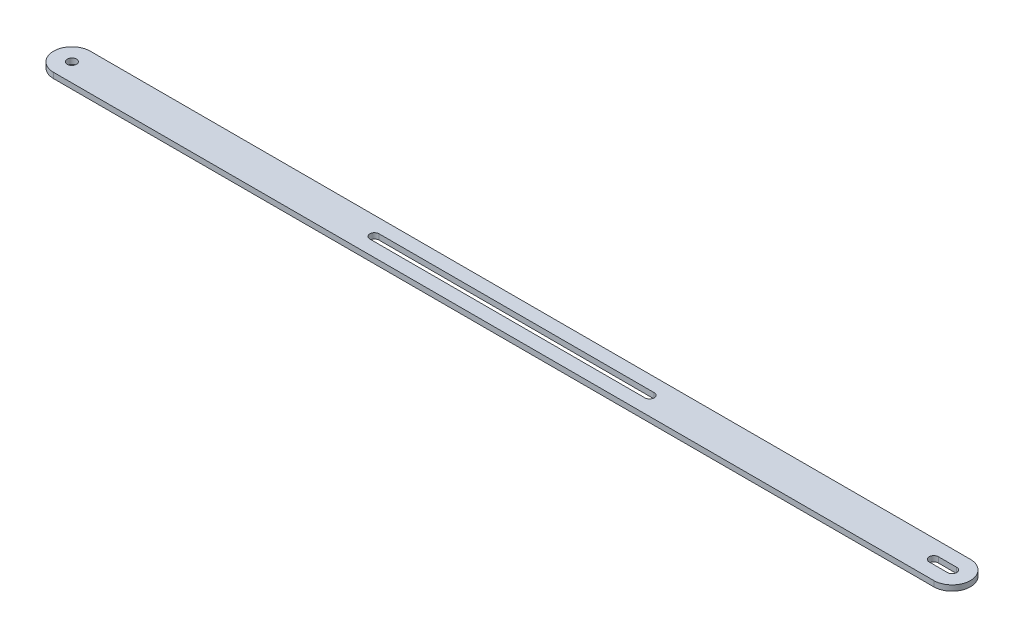
from build123d import *

# Parameters (mm, degrees)
SKETCH1_R           = 2.5
BOSS_EXTRUDE1_DEPTH = 3
CUT_EXTRUDE1_DEPTH  = 251.217905035


with BuildPart() as part:
    # Sketch1 → Boss-Extrude1 (new body)
    with BuildSketch(Plane(origin=(0, 0, 0), x_dir=(1, 0, 0), z_dir=(0, 1, 0))):
        with BuildLine():
            Line((-240, 10), (240, 10))
            ThreePointArc((240, 10), (250, 0), (240, -10))
            Line((240, -10), (-240, -10))
            ThreePointArc((-240, -10), (-250, 0), (-240, 10))
        make_face()
        with Locations((-240, 0)):
            Circle(SKETCH1_R, mode=Mode.SUBTRACT)
        with BuildLine():
            Line((240, -2.5), (230, -2.5))
            ThreePointArc((230, -2.5), (227.5, 0), (230, 2.5))
            Line((230, 2.5), (240, 2.5))
            ThreePointArc((240, 2.5), (242.5, 0), (240, -2.5))
        make_face(mode=Mode.SUBTRACT)
    extrude(amount=BOSS_EXTRUDE1_DEPTH)

    # Sketch2 → Cut-Extrude1 (cut, through all)
    with BuildSketch(Plane(origin=(0, 3, 0), x_dir=(1, 0, 0), z_dir=(0, 1, 0))):
        with BuildLine():
            Line((-75, 2.5), (75, 2.5))
            ThreePointArc((75, 2.5), (77.5, 0), (75, -2.5))
            Line((75, -2.5), (-75, -2.5))
            ThreePointArc((-75, -2.5), (-77.5, 0), (-75, 2.5))
        make_face()
    extrude(amount=-CUT_EXTRUDE1_DEPTH, mode=Mode.SUBTRACT)


solid = part.part
